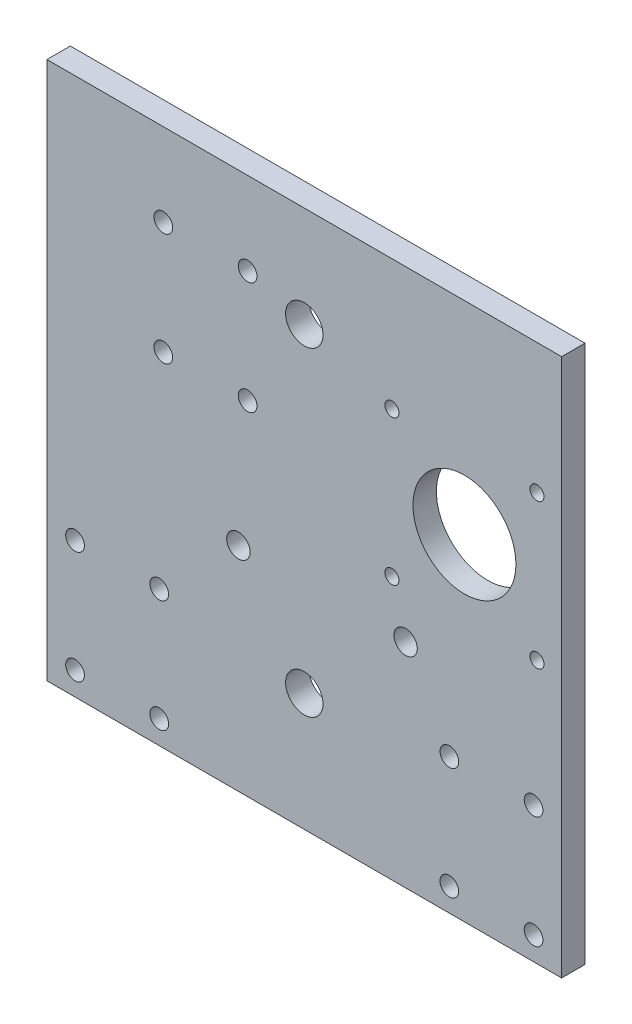
from build123d import *

# Parameters (mm, degrees)
SKETCH1_W           = 110
SKETCH1_H           = 115
SKETCH1_R           = 2
SKETCH1_R_2         = 11
SKETCH1_R_3         = 1.5
SKETCH1_R_4         = 4
SKETCH1_R_5         = 2.5
BOSS_EXTRUDE1_DEPTH = 5


with BuildPart() as part:
    # Sketch1 → Boss-Extrude1 (new body)
    with BuildSketch(Plane.XY):
        with Locations((0, -4.851163613)):
            Rectangle(SKETCH1_W, SKETCH1_H)
        with Locations((-31, -33.351163613)):
            Circle(SKETCH1_R, mode=Mode.SUBTRACT)
        with Locations((-49, -33.351163613)):
            Circle(SKETCH1_R, mode=Mode.SUBTRACT)
        with Locations((-49, -57.351163613)):
            Circle(SKETCH1_R, mode=Mode.SUBTRACT)
        with Locations((-31, -57.351163613)):
            Circle(SKETCH1_R, mode=Mode.SUBTRACT)
        with Locations((49, -33.351163613)):
            Circle(SKETCH1_R, mode=Mode.SUBTRACT)
        with Locations((31, -33.351163613)):
            Circle(SKETCH1_R, mode=Mode.SUBTRACT)
        with Locations((31, -57.351163613)):
            Circle(SKETCH1_R, mode=Mode.SUBTRACT)
        with Locations((49, -57.351163613)):
            Circle(SKETCH1_R, mode=Mode.SUBTRACT)
        with Locations((34.225747303, 9.328776995)):
            Circle(SKETCH1_R_2, mode=Mode.SUBTRACT)
        with Locations((49.725747303, 24.828776995)):
            Circle(SKETCH1_R_3, mode=Mode.SUBTRACT)
        with Locations((49.725747303, -6.171223005)):
            Circle(SKETCH1_R_3, mode=Mode.SUBTRACT)
        with Locations((18.725747303, -6.171223005)):
            Circle(SKETCH1_R_3, mode=Mode.SUBTRACT)
        with Locations((18.725747303, 24.828776995)):
            Circle(SKETCH1_R_3, mode=Mode.SUBTRACT)
        with Locations((0, 31.148836387)):
            Circle(SKETCH1_R_4, mode=Mode.SUBTRACT)
        with Locations((0, -37.151163613)):
            Circle(SKETCH1_R_4, mode=Mode.SUBTRACT)
        with Locations((-12.117054537, 34.957603341)):
            Circle(SKETCH1_R, mode=Mode.SUBTRACT)
        with Locations((-30.130204968, 34.957603341)):
            Circle(SKETCH1_R, mode=Mode.SUBTRACT)
        with Locations((-30.130204968, 10.940069433)):
            Circle(SKETCH1_R, mode=Mode.SUBTRACT)
        with Locations((-12.117054537, 10.940069433)):
            Circle(SKETCH1_R, mode=Mode.SUBTRACT)
        with Locations((21.651303177, -16.823771248)):
            Circle(SKETCH1_R_5, mode=Mode.SUBTRACT)
        with Locations((-14.082283295, -16.823771248)):
            Circle(SKETCH1_R_5, mode=Mode.SUBTRACT)
    extrude(amount=BOSS_EXTRUDE1_DEPTH)


solid = part.part
